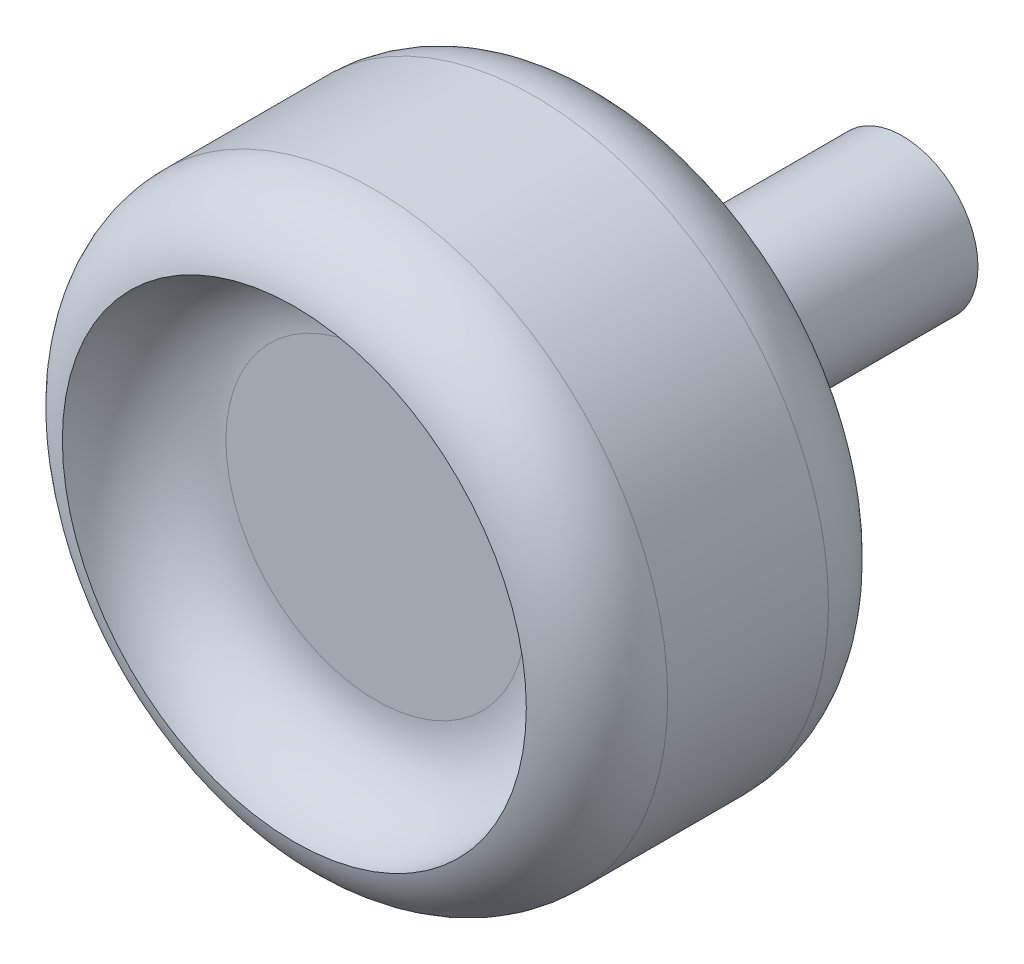
from build123d import *

# Parameters (mm, degrees)
SKETCH1_R           = 2.345368149
BOSS_EXTRUDE1_DEPTH = 8.89
SKETCH2_R           = 9.131634977
BOSS_EXTRUDE2_DEPTH = 10
SKETCH3_R           = 7.205640658
CUT_EXTRUDE1_DEPTH  = 2.54
FILLET1_R           = 2.54
FILLET2_R           = 2.54


# Some blends are built 0.0001 mm under size
with BuildPart() as part:
    # Sketch1 → Boss-Extrude1 (new body)
    with BuildSketch(Plane.XY):
        with Locations((21.750777604, -13.836740686)):
            Circle(SKETCH1_R)
    extrude(amount=BOSS_EXTRUDE1_DEPTH)

    # Sketch2 → Boss-Extrude2 (add)
    with BuildSketch(Plane.XY.offset(8.89)):
        with Locations((21.750777604, -13.836740686)):
            Circle(SKETCH2_R)
    extrude(amount=BOSS_EXTRUDE2_DEPTH)

    # Sketch3 → Cut-Extrude1 (cut)
    with BuildSketch(Plane.XY.offset(18.89)):
        with Locations((21.750777604, -13.836740686)):
            Circle(SKETCH3_R)
    extrude(amount=-CUT_EXTRUDE1_DEPTH, mode=Mode.SUBTRACT)

    # Fillet1
    fillet1_edges = [part.edges().sort_by_distance(p)[0] for p in [
        (14.545136946, -13.836740686, 16.35),
    ]]
    fillet(fillet1_edges, radius=FILLET1_R - 0.0001)  # a hair under: the kernel refuses the full size

    # Fillet2
    # the kernel refuses this fillet: 2.54 mm, written as the material it takes off along each edge
    with BuildSketch(Plane(origin=(21.750777604, -13.836740686, 8.89), x_dir=(1, 0, 0), z_dir=(0, -1, 0))) as fillet2_piece_1:
        with BuildLine():
            CenterArc((9.131634977 - FILLET2_R, FILLET2_R), FILLET2_R, 270, 90)
            Line((9.131634977 - FILLET2_R, 0), (9.131634977 - FILLET2_R, -FILLET2_R * 0.02))
            Line((9.131634977 - FILLET2_R, -FILLET2_R * 0.02), (9.131634977 + FILLET2_R * 0.02, -FILLET2_R * 0.02))
            Line((9.131634977 + FILLET2_R * 0.02, -FILLET2_R * 0.02), (9.131634977 + FILLET2_R * 0.02, FILLET2_R))
            Line((9.131634977 + FILLET2_R * 0.02, FILLET2_R), (9.131634977, FILLET2_R))
        make_face()
    revolve(axis=Axis((21.750777604, -13.836740686, 8.89), (0, 0, 1)), mode=Mode.SUBTRACT)
    with BuildSketch(Plane(origin=(21.750777604, -13.836740686, 18.89), x_dir=(1, 0, 0), z_dir=(0, -1, 0))) as fillet2_piece_2:
        with BuildLine():
            CenterArc((6.591634977, -2.46466976), FILLET2_R, 0, 76.011064225)
            Line((9.131634977, -2.46466976), (9.182434977, -2.46466976))
            Line((9.182434977, -2.46466976), (9.182434977, 0))
            Line((9.182434977, 0), (9.131634977, 0.0508))
            ThreePointArc((9.131634977, 0.0508), (8.168637817, 0.0508), (7.217920771, 0.049293395))
            Line((7.217920771, 0.049293395), (7.205640658, 0))
        make_face()
    revolve(axis=Axis((21.750777604, -13.836740686, 18.89), (0, 0, 1)), mode=Mode.SUBTRACT)


solid = part.part
